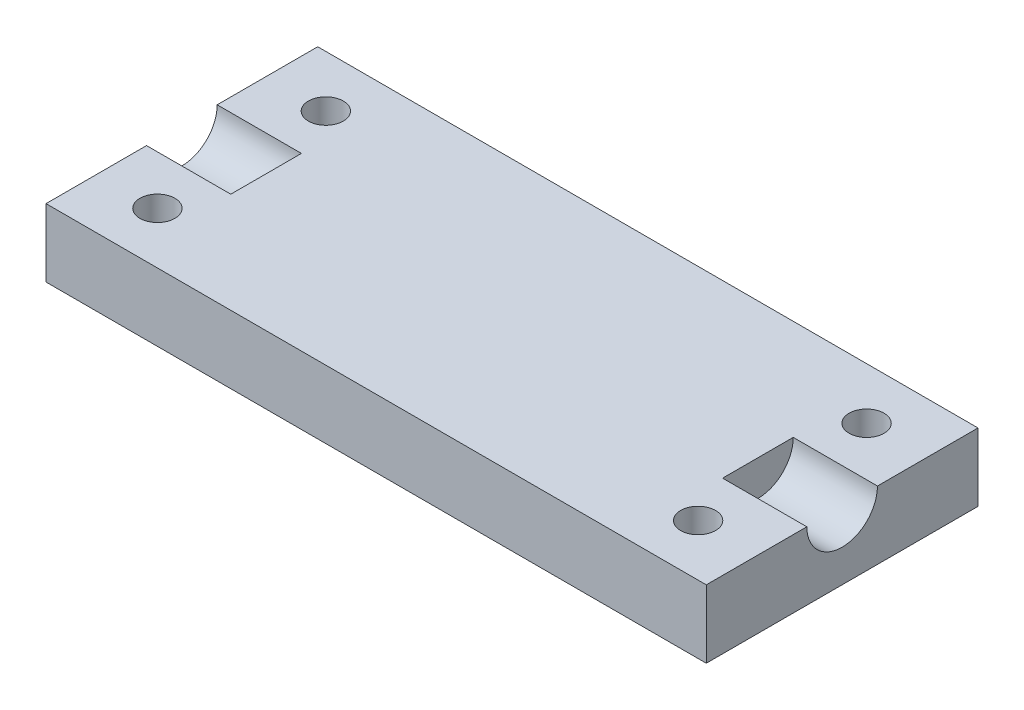
from build123d import *

# Parameters (mm, degrees)
SKETCH1_W           = 61.722
SKETCH1_H           = 25.4
BOSS_EXTRUDE1_DEPTH = 6.35
SKETCH2_R           = 3.302
CUT_EXTRUDE1_DEPTH  = 7.874
CUT_EXTRUDE2_START  = -7.874
SKETCH3_R           = 3.302
CUT_EXTRUDE2_DEPTH  = 7.874
CUT_EXTRUDE11_REACH = 35.971
SKETCH4_R           = 1.63195


with BuildPart() as part:
    # Sketch1 → Boss-Extrude1 (new body)
    with BuildSketch(Plane(origin=(0, 0, 0), x_dir=(1, 0, 0), z_dir=(0, 1, 0))):
        Rectangle(SKETCH1_W, SKETCH1_H)
    extrude(amount=-BOSS_EXTRUDE1_DEPTH)

    # Sketch2 → Cut-Extrude1 (cut)
    with BuildSketch(Plane(origin=(30.861, 0, 0), x_dir=(0, 0, -1), z_dir=(1, 0, 0))):
        Circle(SKETCH2_R)
    extrude(amount=-CUT_EXTRUDE1_DEPTH, mode=Mode.SUBTRACT)

    # Sketch3 → Cut-Extrude2 (cut)
    with BuildSketch(Plane.ZY.offset(30.861).offset(CUT_EXTRUDE2_START)):
        Circle(SKETCH3_R)
    extrude(amount=CUT_EXTRUDE2_DEPTH, mode=Mode.SUBTRACT)

    # Sketch4 → Cut-Extrude11 (cut, up to next)
    with BuildSketch(Plane(origin=(0, 0, 0), x_dir=(1, 0, 0), z_dir=(0, 1, 0)), mode=Mode.PRIVATE) as cut_extrude11_sk1:
        with Locations((25.273, -7.874)):
            Circle(SKETCH4_R)
    cut_extrude11_tool1 = extrude(cut_extrude11_sk1.sketch, amount=-CUT_EXTRUDE11_REACH, mode=Mode.PRIVATE) & part.part
    # Sketch4 → Cut-Extrude11 (cut, up to next)
    with BuildSketch(Plane(origin=(0, 0, 0), x_dir=(1, 0, 0), z_dir=(0, 1, 0)), mode=Mode.PRIVATE) as cut_extrude11_sk2:
        with Locations((25.273, 7.874)):
            Circle(SKETCH4_R)
    cut_extrude11_tool2 = extrude(cut_extrude11_sk2.sketch, amount=-CUT_EXTRUDE11_REACH, mode=Mode.PRIVATE) & part.part
    # Sketch4 → Cut-Extrude11 (cut, up to next)
    with BuildSketch(Plane(origin=(0, 0, 0), x_dir=(1, 0, 0), z_dir=(0, 1, 0)), mode=Mode.PRIVATE) as cut_extrude11_sk3:
        with Locations((-25.273, 7.874)):
            Circle(SKETCH4_R)
    cut_extrude11_tool3 = extrude(cut_extrude11_sk3.sketch, amount=-CUT_EXTRUDE11_REACH, mode=Mode.PRIVATE) & part.part
    # Sketch4 → Cut-Extrude11 (cut, up to next)
    with BuildSketch(Plane(origin=(0, 0, 0), x_dir=(1, 0, 0), z_dir=(0, 1, 0)), mode=Mode.PRIVATE) as cut_extrude11_sk4:
        with Locations((-25.273, -7.874)):
            Circle(SKETCH4_R)
    cut_extrude11_tool4 = extrude(cut_extrude11_sk4.sketch, amount=-CUT_EXTRUDE11_REACH, mode=Mode.PRIVATE) & part.part
    add(cut_extrude11_tool1.solids().sort_by_distance((25.273, 0, 7.874))[0], mode=Mode.SUBTRACT)
    add(cut_extrude11_tool2.solids().sort_by_distance((25.273, 0, -7.874))[0], mode=Mode.SUBTRACT)
    add(cut_extrude11_tool3.solids().sort_by_distance((-25.273, 0, -7.874))[0], mode=Mode.SUBTRACT)
    add(cut_extrude11_tool4.solids().sort_by_distance((-25.273, 0, 7.874))[0], mode=Mode.SUBTRACT)


solid = part.part
